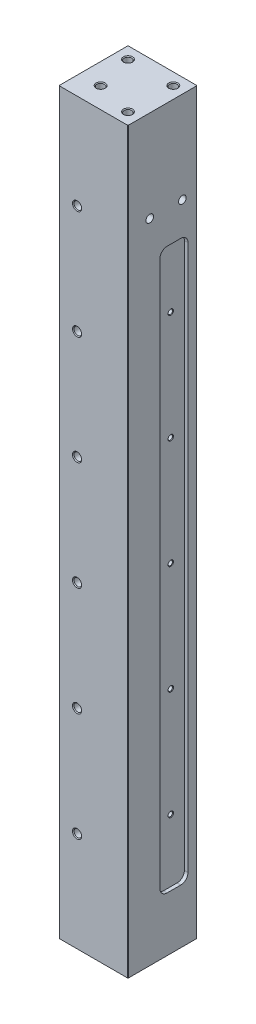
from build123d import *

# Parameters (mm, degrees)
SKETCH1_W                       = 38.1
SKETCH1_H                       = 38.1
BOSS_EXTRUDE1_DEPTH             = 490
M5X0_8_TAPPED_HOLE1_AT_2_COUNT  = 2
M5X0_8_TAPPED_HOLE1_AT_2_PITCH  = 60
M5X0_8_TAPPED_HOLE1_AT_3_COUNT  = 2
M5X0_8_TAPPED_HOLE1_AT_3_PITCH  = 120
M5X0_8_TAPPED_HOLE1_AT_4_COUNT  = 2
M5X0_8_TAPPED_HOLE1_AT_4_PITCH  = 180
M5X0_8_TAPPED_HOLE1_AT_5_COUNT  = 2
M5X0_8_TAPPED_HOLE1_AT_5_PITCH  = 240
M5X0_8_TAPPED_HOLE1_AT_6_COUNT  = 2
M5X0_8_TAPPED_HOLE1_AT_6_PITCH  = 300
M5X0_8_TAPPED_HOLE1_AT_7_COUNT  = 2
M5X0_8_TAPPED_HOLE1_AT_7_PITCH  = 360
M5X0_8_TAPPED_HOLE1_AT_8_COUNT  = 2
M5X0_8_TAPPED_HOLE1_AT_8_PITCH  = 420
M5X0_8_TAPPED_HOLE3_AT_2_COUNT  = 2
M5X0_8_TAPPED_HOLE3_AT_2_PITCH  = 18
SKETCH11_W                      = 15.5
SKETCH11_H                      = 309
CUT_EXTRUDE1_DEPTH              = 2
FILLET1_R                       = 4
M3X0_5_TAPPED_HOLE1_AT_2_COUNT  = 2
M3X0_5_TAPPED_HOLE1_AT_2_PITCH  = 60
M3X0_5_TAPPED_HOLE1_AT_3_COUNT  = 2
M3X0_5_TAPPED_HOLE1_AT_3_PITCH  = 120
M3X0_5_TAPPED_HOLE1_AT_4_COUNT  = 2
M3X0_5_TAPPED_HOLE1_AT_4_PITCH  = 180
M3X0_5_TAPPED_HOLE1_AT_5_COUNT  = 2
M3X0_5_TAPPED_HOLE1_AT_5_PITCH  = 240
FILLET1_OF_MIRROR2_R            = 4
SKETCH14_W                      = 38.1
SKETCH14_H                      = 38.1
CUT_EXTRUDE2_DEPTH              = 82.5
M6X1_0_TAPPED_HOLE1_D           = 5
M6X1_0_TAPPED_HOLE1_DEPTH       = 17
M6X1_0_TAPPED_HOLE1_CSINK_D     = 6.05
M6X1_0_TAPPED_HOLE1_CSINK_ANGLE = 90
M6X1_0_TAPPED_HOLE1_TIP         = 1.502151548
CHAMFER1_SIZE                   = 0.25
M5X0_8_TAPPED_HOLE4_D           = 4.2
M5X0_8_TAPPED_HOLE4_DEPTH       = 12.4
M5X0_8_TAPPED_HOLE4_CSINK_D     = 5.05
M5X0_8_TAPPED_HOLE4_CSINK_ANGLE = 90
M5X0_8_TAPPED_HOLE4_TIP         = 1.2618073
M5X0_8_TAPPED_HOLE5_D           = 4.2
M5X0_8_TAPPED_HOLE5_DEPTH       = 12.4
M5X0_8_TAPPED_HOLE5_CSINK_D     = 5.05
M5X0_8_TAPPED_HOLE5_CSINK_ANGLE = 90
M5X0_8_TAPPED_HOLE5_TIP         = 1.2618073


with BuildPart() as part:
    # Sketch1 → Boss-Extrude1 (new body)
    with BuildSketch(Plane(origin=(0, 0, 0), x_dir=(1, 0, 0), z_dir=(0, 1, 0))):
        Rectangle(SKETCH1_W, SKETCH1_H)
    extrude(amount=BOSS_EXTRUDE1_DEPTH)

    # Sketch6 → M5x0.8 Tapped Hole1 (revolve, cut)
    with BuildSketch(Plane(origin=(-19.05, 475, 9.05), x_dir=(0, 0, 1), z_dir=(0, 1, 0))):
        Polygon((0, 0), (0, 8.6618073), (2.1, 7.4), (2.1, 0.425), (2.525, 0), align=None)
    m5x0_8_tapped_hole1 = revolve(axis=Axis((-25.4, 475, 9.05), (1, 0, 0)), mode=Mode.SUBTRACT)

    # M5x0.8 Tapped Hole1 at 2: M5x0.8 Tapped Hole1 ×2
    with Locations(*[(0, -i * M5X0_8_TAPPED_HOLE1_AT_2_PITCH, 0) for i in range(1, M5X0_8_TAPPED_HOLE1_AT_2_COUNT)]):
        add(m5x0_8_tapped_hole1, mode=Mode.SUBTRACT)

    # M5x0.8 Tapped Hole1 at 3: M5x0.8 Tapped Hole1 ×2
    with Locations(*[(0, -i * M5X0_8_TAPPED_HOLE1_AT_3_PITCH, 0) for i in range(1, M5X0_8_TAPPED_HOLE1_AT_3_COUNT)]):
        add(m5x0_8_tapped_hole1, mode=Mode.SUBTRACT)

    # M5x0.8 Tapped Hole1 at 4: M5x0.8 Tapped Hole1 ×2
    with Locations(*[(0, -i * M5X0_8_TAPPED_HOLE1_AT_4_PITCH, 0) for i in range(1, M5X0_8_TAPPED_HOLE1_AT_4_COUNT)]):
        add(m5x0_8_tapped_hole1, mode=Mode.SUBTRACT)

    # M5x0.8 Tapped Hole1 at 5: M5x0.8 Tapped Hole1 ×2
    with Locations(*[(0, -i * M5X0_8_TAPPED_HOLE1_AT_5_PITCH, 0) for i in range(1, M5X0_8_TAPPED_HOLE1_AT_5_COUNT)]):
        add(m5x0_8_tapped_hole1, mode=Mode.SUBTRACT)

    # M5x0.8 Tapped Hole1 at 6: M5x0.8 Tapped Hole1 ×2
    with Locations(*[(0, -i * M5X0_8_TAPPED_HOLE1_AT_6_PITCH, 0) for i in range(1, M5X0_8_TAPPED_HOLE1_AT_6_COUNT)]):
        add(m5x0_8_tapped_hole1, mode=Mode.SUBTRACT)

    # M5x0.8 Tapped Hole1 at 7: M5x0.8 Tapped Hole1 ×2
    with Locations(*[(0, -i * M5X0_8_TAPPED_HOLE1_AT_7_PITCH, 0) for i in range(1, M5X0_8_TAPPED_HOLE1_AT_7_COUNT)]):
        add(m5x0_8_tapped_hole1, mode=Mode.SUBTRACT)

    # M5x0.8 Tapped Hole1 at 8: M5x0.8 Tapped Hole1 ×2
    with Locations(*[(0, -i * M5X0_8_TAPPED_HOLE1_AT_8_PITCH, 0) for i in range(1, M5X0_8_TAPPED_HOLE1_AT_8_COUNT)]):
        add(m5x0_8_tapped_hole1, mode=Mode.SUBTRACT)

    # Sketch10 → M5x0.8 Tapped Hole3 (revolve, cut)
    with BuildSketch(Plane(origin=(19.05, 357, 7.05), x_dir=(0, 0, -1), z_dir=(0, 1, 0))):
        Polygon((0, 0), (0, 7.6618073), (2.1, 6.4), (2.1, 0), align=None)
    m5x0_8_tapped_hole3 = revolve(axis=Axis((25.4, 357, 7.05), (-1, 0, 0)), mode=Mode.SUBTRACT)

    # M5x0.8 Tapped Hole3 at 2: M5x0.8 Tapped Hole3 ×2
    with Locations(*[(0, 0, -i * M5X0_8_TAPPED_HOLE3_AT_2_PITCH) for i in range(1, M5X0_8_TAPPED_HOLE3_AT_2_COUNT)]):
        add(m5x0_8_tapped_hole3, mode=Mode.SUBTRACT)

    # Sketch11 → Cut-Extrude1 (cut)
    with BuildSketch(Plane(origin=(19.05, 0, 0), x_dir=(0, 0, -1), z_dir=(1, 0, 0))):
        with Locations((6.3, 184.5)):
            Rectangle(SKETCH11_W, SKETCH11_H)
    cut_extrude1 = extrude(amount=-CUT_EXTRUDE1_DEPTH, mode=Mode.SUBTRACT)

    # Fillet1
    fillet1_edges = [part.edges().sort_by_distance(p)[0] for p in [
        (18.05, 30, 1.45),
        (18.05, 30, -14.05),
        (18.05, 339, -14.05),
        (18.05, 339, 1.45),
    ]]
    fillet(fillet1_edges, radius=FILLET1_R)

    # Sketch13 → M3x0.5 Tapped Hole1 (revolve, cut)
    with BuildSketch(Plane(origin=(17.05, 64.5, -6.55), x_dir=(0, 0, -1), z_dir=(0, 1, 0))):
        Polygon((0, 0), (0, 8.251075774), (1.25, 7.5), (1.25, 0.275), (1.525, 0), align=None)
    m3x0_5_tapped_hole1 = revolve(axis=Axis((23.4, 64.5, -6.55), (-1, 0, 0)), mode=Mode.SUBTRACT)

    # M3x0.5 Tapped Hole1 at 2: M3x0.5 Tapped Hole1 ×2
    with Locations(*[(0, i * M3X0_5_TAPPED_HOLE1_AT_2_PITCH, 0) for i in range(1, M3X0_5_TAPPED_HOLE1_AT_2_COUNT)]):
        add(m3x0_5_tapped_hole1, mode=Mode.SUBTRACT)

    # M3x0.5 Tapped Hole1 at 3: M3x0.5 Tapped Hole1 ×2
    with Locations(*[(0, i * M3X0_5_TAPPED_HOLE1_AT_3_PITCH, 0) for i in range(1, M3X0_5_TAPPED_HOLE1_AT_3_COUNT)]):
        add(m3x0_5_tapped_hole1, mode=Mode.SUBTRACT)

    # M3x0.5 Tapped Hole1 at 4: M3x0.5 Tapped Hole1 ×2
    with Locations(*[(0, i * M3X0_5_TAPPED_HOLE1_AT_4_PITCH, 0) for i in range(1, M3X0_5_TAPPED_HOLE1_AT_4_COUNT)]):
        add(m3x0_5_tapped_hole1, mode=Mode.SUBTRACT)

    # M3x0.5 Tapped Hole1 at 5: M3x0.5 Tapped Hole1 ×2
    with Locations(*[(0, i * M3X0_5_TAPPED_HOLE1_AT_5_PITCH, 0) for i in range(1, M3X0_5_TAPPED_HOLE1_AT_5_COUNT)]):
        add(m3x0_5_tapped_hole1, mode=Mode.SUBTRACT)

    # Mirror2: M5x0.8 Tapped Hole1, M5x0.8 Tapped Hole3, Cut-Extrude1, M3x0.5 Tapped Hole1 across plane
    add(m5x0_8_tapped_hole1.mirror(Plane(origin=(0, 0, 0), x_dir=(-0.7071067811865475, 0, 0.7071067811865477), z_dir=(-0.7071067811865476, 0, -0.7071067811865475))), mode=Mode.SUBTRACT)
    add(m5x0_8_tapped_hole3.mirror(Plane(origin=(0, 0, 0), x_dir=(-0.7071067811865475, 0, 0.7071067811865477), z_dir=(-0.7071067811865476, 0, -0.7071067811865475))), mode=Mode.SUBTRACT)
    add(cut_extrude1.mirror(Plane(origin=(0, 0, 0), x_dir=(-0.7071067811865475, 0, 0.7071067811865477), z_dir=(-0.7071067811865476, 0, -0.7071067811865475))), mode=Mode.SUBTRACT)
    add(m3x0_5_tapped_hole1.mirror(Plane(origin=(0, 0, 0), x_dir=(-0.7071067811865475, 0, 0.7071067811865477), z_dir=(-0.7071067811865476, 0, -0.7071067811865475))), mode=Mode.SUBTRACT)

    # Mirror2 copy 1 sketch → Mirror2 copy 1 (revolve, cut)
    with BuildSketch(Plane(origin=(-9.05, 415, 19.05), x_dir=(-1, 0, 0), z_dir=(0, 1, 0))):
        Polygon((0, 0), (0, -8.6618073), (2.1, -7.4), (2.1, -0.425), (2.525, 0), align=None)
    revolve(axis=Axis((-9.05, 415, 25.4), (0, 0, 1)), mode=Mode.SUBTRACT)

    # Mirror2 copy 2 sketch → Mirror2 copy 2 (revolve, cut)
    with BuildSketch(Plane(origin=(-9.05, 355, 19.05), x_dir=(-1, 0, 0), z_dir=(0, 1, 0))):
        Polygon((0, 0), (0, -8.6618073), (2.1, -7.4), (2.1, -0.425), (2.525, 0), align=None)
    revolve(axis=Axis((-9.05, 355, 25.4), (0, 0, 1)), mode=Mode.SUBTRACT)

    # Mirror2 copy 3 sketch → Mirror2 copy 3 (revolve, cut)
    with BuildSketch(Plane(origin=(-9.05, 295, 19.05), x_dir=(-1, 0, 0), z_dir=(0, 1, 0))):
        Polygon((0, 0), (0, -8.6618073), (2.1, -7.4), (2.1, -0.425), (2.525, 0), align=None)
    revolve(axis=Axis((-9.05, 295, 25.4), (0, 0, 1)), mode=Mode.SUBTRACT)

    # Mirror2 copy 4 sketch → Mirror2 copy 4 (revolve, cut)
    with BuildSketch(Plane(origin=(-9.05, 235, 19.05), x_dir=(-1, 0, 0), z_dir=(0, 1, 0))):
        Polygon((0, 0), (0, -8.6618073), (2.1, -7.4), (2.1, -0.425), (2.525, 0), align=None)
    revolve(axis=Axis((-9.05, 235, 25.4), (0, 0, 1)), mode=Mode.SUBTRACT)

    # Mirror2 copy 5 sketch → Mirror2 copy 5 (revolve, cut)
    with BuildSketch(Plane(origin=(-9.05, 175, 19.05), x_dir=(-1, 0, 0), z_dir=(0, 1, 0))):
        Polygon((0, 0), (0, -8.6618073), (2.1, -7.4), (2.1, -0.425), (2.525, 0), align=None)
    revolve(axis=Axis((-9.05, 175, 25.4), (0, 0, 1)), mode=Mode.SUBTRACT)

    # Mirror2 copy 6 sketch → Mirror2 copy 6 (revolve, cut)
    with BuildSketch(Plane(origin=(-9.05, 115, 19.05), x_dir=(-1, 0, 0), z_dir=(0, 1, 0))):
        Polygon((0, 0), (0, -8.6618073), (2.1, -7.4), (2.1, -0.425), (2.525, 0), align=None)
    revolve(axis=Axis((-9.05, 115, 25.4), (0, 0, 1)), mode=Mode.SUBTRACT)

    # Mirror2 copy 7 sketch → Mirror2 copy 7 (revolve, cut)
    with BuildSketch(Plane(origin=(-9.05, 55, 19.05), x_dir=(-1, 0, 0), z_dir=(0, 1, 0))):
        Polygon((0, 0), (0, -8.6618073), (2.1, -7.4), (2.1, -0.425), (2.525, 0), align=None)
    revolve(axis=Axis((-9.05, 55, 25.4), (0, 0, 1)), mode=Mode.SUBTRACT)

    # Mirror2 copy 8 sketch → Mirror2 copy 8 (revolve, cut)
    with BuildSketch(Plane(origin=(10.95, 357, -19.05), x_dir=(1, 0, 0), z_dir=(0, 1, 0))):
        Polygon((0, 0), (0, -7.6618073), (2.1, -6.4), (2.1, 0), align=None)
    revolve(axis=Axis((10.95, 357, -25.4), (0, 0, -1)), mode=Mode.SUBTRACT)

    # Mirror2 copy 9 sketch → Mirror2 copy 9 (revolve, cut)
    with BuildSketch(Plane(origin=(6.55, 124.5, -17.05), x_dir=(1, 0, 0), z_dir=(0, 1, 0))):
        Polygon((0, 0), (0, -8.251075774), (1.25, -7.5), (1.25, -0.275), (1.525, 0), align=None)
    revolve(axis=Axis((6.55, 124.5, -23.4), (0, 0, -1)), mode=Mode.SUBTRACT)

    # Mirror2 copy 10 sketch → Mirror2 copy 10 (revolve, cut)
    with BuildSketch(Plane(origin=(6.55, 184.5, -17.05), x_dir=(1, 0, 0), z_dir=(0, 1, 0))):
        Polygon((0, 0), (0, -8.251075774), (1.25, -7.5), (1.25, -0.275), (1.525, 0), align=None)
    revolve(axis=Axis((6.55, 184.5, -23.4), (0, 0, -1)), mode=Mode.SUBTRACT)

    # Mirror2 copy 11 sketch → Mirror2 copy 11 (revolve, cut)
    with BuildSketch(Plane(origin=(6.55, 244.5, -17.05), x_dir=(1, 0, 0), z_dir=(0, 1, 0))):
        Polygon((0, 0), (0, -8.251075774), (1.25, -7.5), (1.25, -0.275), (1.525, 0), align=None)
    revolve(axis=Axis((6.55, 244.5, -23.4), (0, 0, -1)), mode=Mode.SUBTRACT)

    # Mirror2 copy 12 sketch → Mirror2 copy 12 (revolve, cut)
    with BuildSketch(Plane(origin=(6.55, 304.5, -17.05), x_dir=(1, 0, 0), z_dir=(0, 1, 0))):
        Polygon((0, 0), (0, -8.251075774), (1.25, -7.5), (1.25, -0.275), (1.525, 0), align=None)
    revolve(axis=Axis((6.55, 304.5, -23.4), (0, 0, -1)), mode=Mode.SUBTRACT)

    # Fillet1 of Mirror2
    fillet1_of_mirror2_edges = [part.edges().sort_by_distance(p)[0] for p in [
        (-1.45, 30, -18.05),
        (14.05, 30, -18.05),
        (14.05, 339, -18.05),
        (-1.45, 339, -18.05),
    ]]
    fillet(fillet1_of_mirror2_edges, radius=FILLET1_OF_MIRROR2_R)

    # Sketch14 → Cut-Extrude2 (cut)
    with BuildSketch(Plane(origin=(0, 490, 0), x_dir=(1, 0, 0), z_dir=(0, 1, 0))):
        Rectangle(SKETCH14_W, SKETCH14_H)
    extrude(amount=-CUT_EXTRUDE2_DEPTH, mode=Mode.SUBTRACT)

    # M6x1.0 Tapped Hole1
    with Locations(Plane(origin=(0, 0, 0), x_dir=(-1, 0, 0), z_dir=(0, -1, 0))):
        with Locations((7.55, -7.55)):
            CounterSinkHole(M6X1_0_TAPPED_HOLE1_D / 2, M6X1_0_TAPPED_HOLE1_CSINK_D / 2, depth=M6X1_0_TAPPED_HOLE1_DEPTH, counter_sink_angle=M6X1_0_TAPPED_HOLE1_CSINK_ANGLE)
            with Locations((0, 0, -(M6X1_0_TAPPED_HOLE1_DEPTH + M6X1_0_TAPPED_HOLE1_TIP / 2))):  # 118° drill point
                Cone(0, M6X1_0_TAPPED_HOLE1_D / 2, M6X1_0_TAPPED_HOLE1_TIP, mode=Mode.SUBTRACT)

    # Chamfer1
    chamfer1_edges = [part.edges().sort_by_distance(p)[0] for p in [
        (19.05, 203.75, 19.05),
        (-19.05, 203.75, 19.05),
        (-19.05, 203.75, -19.05),
        (19.05, 203.75, -19.05),
    ]]
    chamfer(chamfer1_edges, length=CHAMFER1_SIZE)

    # M5x0.8 Tapped Hole4
    with Locations(Plane(origin=(0, 0, 0), x_dir=(-1, 0, 0), z_dir=(0, -1, 0))):
        with Locations((-12.5, -12.5), (-12.5, 12.5), (12.5, 12.5)):
            CounterSinkHole(M5X0_8_TAPPED_HOLE4_D / 2, M5X0_8_TAPPED_HOLE4_CSINK_D / 2, depth=M5X0_8_TAPPED_HOLE4_DEPTH, counter_sink_angle=M5X0_8_TAPPED_HOLE4_CSINK_ANGLE)
            with Locations((0, 0, -(M5X0_8_TAPPED_HOLE4_DEPTH + M5X0_8_TAPPED_HOLE4_TIP / 2))):  # 118° drill point
                Cone(0, M5X0_8_TAPPED_HOLE4_D / 2, M5X0_8_TAPPED_HOLE4_TIP, mode=Mode.SUBTRACT)

    # M5x0.8 Tapped Hole5
    with Locations(Plane(origin=(0, 407.5, 0), x_dir=(1, 0, 0), z_dir=(0, 1, 0))):
        with Locations((12.5, 12.5), (-12.5, 12.5), (12.5, -12.5), (-7.55, -7.55)):
            CounterSinkHole(M5X0_8_TAPPED_HOLE5_D / 2, M5X0_8_TAPPED_HOLE5_CSINK_D / 2, depth=M5X0_8_TAPPED_HOLE5_DEPTH, counter_sink_angle=M5X0_8_TAPPED_HOLE5_CSINK_ANGLE)
            with Locations((0, 0, -(M5X0_8_TAPPED_HOLE5_DEPTH + M5X0_8_TAPPED_HOLE5_TIP / 2))):  # 118° drill point
                Cone(0, M5X0_8_TAPPED_HOLE5_D / 2, M5X0_8_TAPPED_HOLE5_TIP, mode=Mode.SUBTRACT)


solid = part.part
